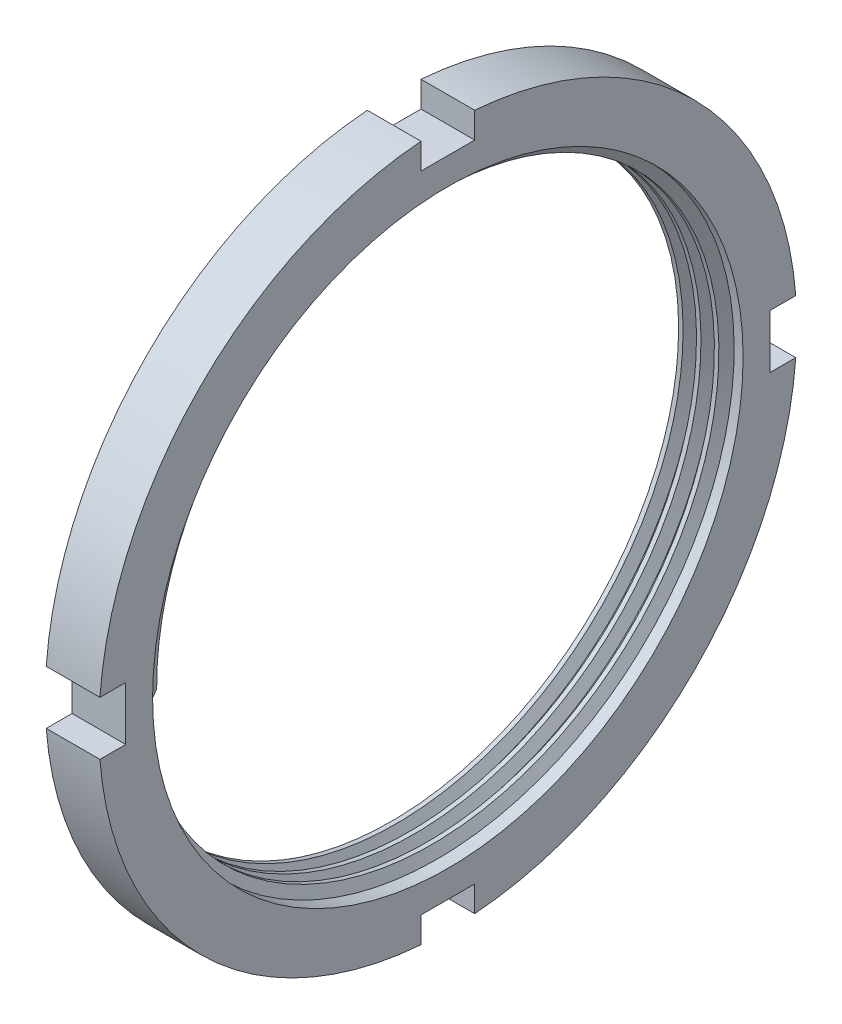
from build123d import *

# Parameters (mm, degrees)
SKETCH1_R           = 20.6375
SKETCH1_R_2         = 17.4625
BOSS_EXTRUDE1_DEPTH = 3.175
THREAD1_PITCH       = 1.058333333
CUT_EXTRUDE1_DEPTH  = 30.47257683
CIRPATTERN1_COUNT   = 4


with BuildPart() as part:
    # Sketch1 → Boss-Extrude1 (new body)
    with BuildSketch(Plane(origin=(0, 0, 0), x_dir=(0, 0, -1), z_dir=(1, 0, 0))):
        Circle(SKETCH1_R)
        Circle(SKETCH1_R_2, mode=Mode.SUBTRACT)
    extrude(amount=BOSS_EXTRUDE1_DEPTH)

    # Thread1: the profile of Thread Profile1 profile screwed along a right-hand helix of 3 turns, 8 arcs to a turn; built about Z, then put on its axis
    thread1_z = Axis((0, 0, 0), (0, 0, 1))
    thread1_corners = [(17.4628, 0, -0.000173205), (17.4628, 0, 0.926214869), (16.889660282, 0, 0.595312499), (16.889660282, 0, 0.330729165)]
    with BuildLine(mode=Mode.PRIVATE) as thread1_profile:
        Line(thread1_corners[0], thread1_corners[1])
        Line(thread1_corners[1], thread1_corners[2])
        Line(thread1_corners[2], thread1_corners[3])
        Line(thread1_corners[3], thread1_corners[0])
    thread1_cap = Face(thread1_profile.wire())
    thread1_turn_angles = [0, 22.5, 45, 67.5, 90, 112.5, 135, 157.5, 180, 202.5, 225, 247.5, 270, 292.5, 315, 337.5, 360]
    thread1_turn_weights = [1, 0.9238795325112867, 1, 0.9238795325112867, 1, 0.9238795325112867, 1, 0.9238795325112867, 1, 0.9238795325112867, 1, 0.9238795325112867, 1, 0.9238795325112867, 1, 0.9238795325112867, 1]
    thread1_turn_rails = [Edge.make_bspline([Vector(p[0], p[1], 0).rotate(thread1_z, thread1_turn_angles[k]) / thread1_turn_weights[k] + Vector(0, 0, p[2] + THREAD1_PITCH * thread1_turn_angles[k] / 360) for k in range(17)], [0, 0, 0, 1, 1, 2, 2, 3, 3, 4, 4, 5, 5, 6, 6, 7, 7, 8, 8, 8], 2, thread1_turn_weights) for p in thread1_corners]
    thread1_turn_sides = [Face.make_surface_from_curves(thread1_turn_rails[p[0]], thread1_turn_rails[p[1]]) for p in [(0, 1), (1, 2), (2, 3), (3, 0)]]
    thread1 = Plane(origin=(3.175, 0, 0), x_dir=(0, 0, 1), z_dir=(-1, 0, 0)) * Solid(Shell([*[p.moved(Location((0, 0, THREAD1_PITCH * i))) for i in range(3) for p in thread1_turn_sides], thread1_cap, thread1_cap.rotate(thread1_z, 1080).moved(Location((0, 0, THREAD1_PITCH * 1080 / 360)))]))
    add(thread1)

    # Sketch4 → Cut-Extrude1 (cut, symmetric)
    with BuildSketch(Plane(origin=(3.175, 0, 0), x_dir=(0, 0, -1), z_dir=(1, 0, 0))):
        Polygon((-1.5875, 124.225317778), (-1.5875, 20.576351717), (-1.5875, 19.05), (1.5875, 19.05), (1.5875, 20.576351717), (1.5875, 124.225317778), (1.5875, 331.523249901), (-1.5875, 331.523249901), align=None)
    cut_extrude1 = extrude(amount=CUT_EXTRUDE1_DEPTH, both=True, mode=Mode.SUBTRACT)

    # CirPattern1: Cut-Extrude1 ×4 about axis
    cirpattern1_axis = Axis((-17.546691261, 0, 0), (1, 0, 0))
    for i in range(1, CIRPATTERN1_COUNT):
        add(cut_extrude1.rotate(cirpattern1_axis, i * 360 / CIRPATTERN1_COUNT), mode=Mode.SUBTRACT)


solid = part.part
